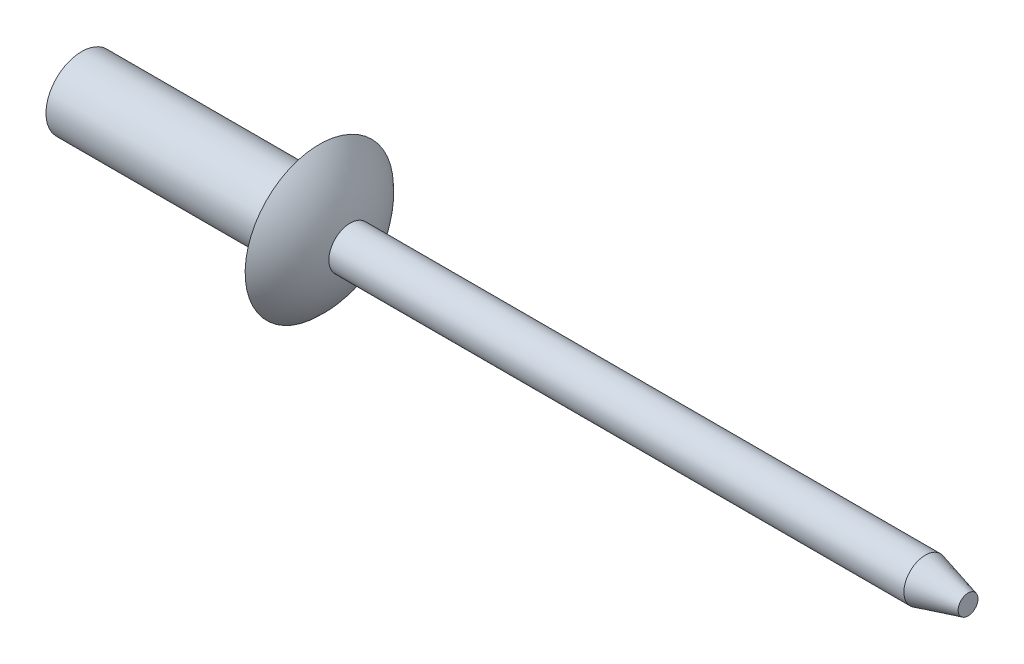
from build123d import *

# Parameters (mm, degrees)
FILLET1_R      = 0.5
CHAMFER1_SIZE  = 1.8
CHAMFER1_SIZE2 = 0.482308546


with BuildPart() as part:
    # Sketch1 → Base-Revolve (revolve)
    with BuildSketch(Plane(origin=(-11.603452862, 14.723452862, 0), x_dir=(0, -1, 0), z_dir=(0, 0, 1))):
        with BuildLine():
            Line((14.723452862, 11.603452862), (16.223452862, 11.603452862))
            Line((16.223452862, 11.603452862), (16.223452862, 21.603452862))
            Line((16.223452862, 21.603452862), (17.843452862, 21.603452862))
            ThreePointArc((17.843452862, 21.603452862), (16.836228646, 22.429648063), (15.623452862, 22.905330759))
            Line((15.623452862, 22.905330759), (15.623452862, 48.905330759))
            Line((15.623452862, 48.905330759), (14.723452862, 48.905330759))
            Line((14.723452862, 48.905330759), (14.723452862, 11.603452862))
        make_face()
    revolve(axis=Axis((22.734231882, 0, 0), (-1, 0, 0)))

    # Fillet1
    fillet1_edges = [part.edges().sort_by_distance(p)[0] for p in [
        (10, 1.5, 0),
    ]]
    fillet(fillet1_edges, radius=FILLET1_R)

    # Chamfer1
    chamfer1_edges = [part.edges().sort_by_distance(p)[0] for p in [
        (37.301877897, 0.9, 0),
    ]]
    chamfer1_side = [part.faces().sort_by_distance(p)[0] for p in [
        (24.301877897, 0.9, 0),
    ]]
    chamfer(chamfer1_edges, length=CHAMFER1_SIZE, length2=CHAMFER1_SIZE2, reference=chamfer1_side[0])


solid = part.part
